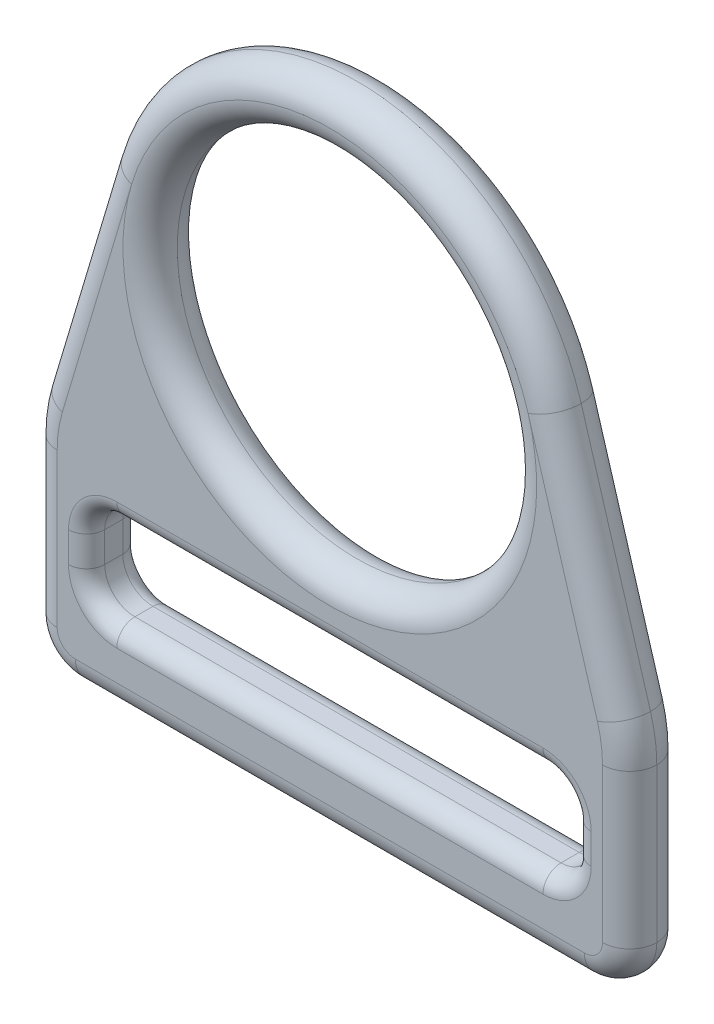
from build123d import *

# Parameters (mm, degrees)
SKETCH2_R                = 2.286
BOSS_EXTRUDE1_DEPTH      = 2.286
BOSS_EXTRUDE1_DEPTH_BACK = 2.286
SKETCH4_R                = 15.128875
FILLET1_R                = 2.286
FILLET2_R                = 1.524


with BuildPart() as part:
    # Sweep1: sweep along a path in Sketch3
    with BuildLine(Plane.XY) as sweep1_path:
        CenterArc((0, -17.414875), 17.414875, 0, 360)
    # Sketch2 → Sweep1 (sweep)
    with BuildSketch(Plane(origin=(0, 0, 0), x_dir=(0, 0, -1), z_dir=(1, 0, 0))):
        Circle(SKETCH2_R)
    sweep(path=sweep1_path.line)

    # Sketch4 → Boss-Extrude1 (add, two sides: drawn at the far end of the back side and taken through both)
    with BuildSketch(Plane.XY.offset(-BOSS_EXTRUDE1_DEPTH_BACK)):
        with BuildLine():
            Line((-18.877175048, -11.777789051), (-24.710258894, -31.311311487))
            ThreePointArc((-24.710258894, -31.311311487), (-25.107801097, -33.108966161), (-25.24125, -34.945210567))
            Line((-25.24125, -34.945210567), (-25.24125, -47.894875))
            ThreePointArc((-25.24125, -47.894875), (-24.125326836, -50.588951836), (-21.43125, -51.704875))
            Line((-21.43125, -51.704875), (21.43125, -51.704875))
            ThreePointArc((21.43125, -51.704875), (24.125326836, -50.588951836), (25.24125, -47.894875))
            Line((25.24125, -47.894875), (25.24125, -34.945210567))
            ThreePointArc((25.24125, -34.945210567), (25.107801097, -33.108966161), (24.710258894, -31.311311487))
            Line((24.710258894, -31.311311487), (18.877175048, -11.777789051))
            ThreePointArc((18.877175048, -11.777789051), (0, 2.286), (-18.877175048, -11.777789051))
        make_face()
        with Locations((0, -17.414875)):
            Circle(SKETCH4_R, mode=Mode.SUBTRACT)
        with BuildLine():
            Line((-20.47875, -40.274875), (-20.47875, -42.814875))
            ThreePointArc((-20.47875, -42.814875), (-19.734801224, -44.610926224), (-17.93875, -45.354875))
            Line((-17.93875, -45.354875), (17.93875, -45.354875))
            ThreePointArc((17.93875, -45.354875), (19.734801224, -44.610926224), (20.47875, -42.814875))
            Line((20.47875, -42.814875), (20.47875, -40.274875))
            ThreePointArc((20.47875, -40.274875), (19.734801224, -38.478823776), (17.93875, -37.734875))
            Line((17.93875, -37.734875), (-17.93875, -37.734875))
            ThreePointArc((-17.93875, -37.734875), (-19.734801224, -38.478823776), (-20.47875, -40.274875))
        make_face(mode=Mode.SUBTRACT)
    extrude(amount=BOSS_EXTRUDE1_DEPTH + BOSS_EXTRUDE1_DEPTH_BACK)

    # Fillet1
    fillet1_edges = [part.edges().sort_by_distance(p)[0] for p in [
        (21.793716971, -21.544550269, 2.286),
        (25.107801097, -33.108966161, 2.286),
        (25.24125, -41.420042784, 2.286),
        (24.125326836, -50.588951836, 2.286),
        (0, -51.704875, 2.286),
        (-24.125326836, -50.588951836, 2.286),
        (-25.24125, -41.420042784, 2.286),
        (-25.107801097, -33.108966161, 2.286),
        (-21.793716971, -21.544550269, 2.286),
        (21.793716971, -21.544550269, -2.286),
        (25.107801097, -33.108966161, -2.286),
        (25.24125, -41.420042784, -2.286),
        (24.125326836, -50.588951836, -2.286),
        (0, -51.704875, -2.286),
        (-24.125326836, -50.588951836, -2.286),
        (-25.24125, -41.420042784, -2.286),
        (-25.107801097, -33.108966161, -2.286),
        (-21.793716971, -21.544550269, -2.286),
        (-15.128875, -17.414875, 2.286),
        (-15.128875, -17.414875, -2.286),
        (0, 2.286, 2.286),
        (0, 2.286, -2.286),
    ]]
    fillet(fillet1_edges, radius=FILLET1_R - 0.0001)  # a hair under: the kernel refuses the full size

    # Fillet2
    fillet2_edges = [part.edges().sort_by_distance(p)[0] for p in [
        (19.734801224, -38.478823776, 2.286),
        (0, -37.734875, 2.286),
        (-19.734801224, -38.478823776, 2.286),
        (-20.47875, -41.544875, 2.286),
        (-19.734801224, -44.610926224, 2.286),
        (0, -45.354875, 2.286),
        (19.734801224, -44.610926224, 2.286),
        (20.47875, -41.544875, 2.286),
        (20.47875, -41.544875, -2.286),
        (19.734801224, -38.478823776, -2.286),
        (0, -37.734875, -2.286),
        (-19.734801224, -38.478823776, -2.286),
        (-20.47875, -41.544875, -2.286),
        (-19.734801224, -44.610926224, -2.286),
        (0, -45.354875, -2.286),
        (19.734801224, -44.610926224, -2.286),
    ]]
    fillet(fillet2_edges, radius=FILLET2_R)


solid = part.part
